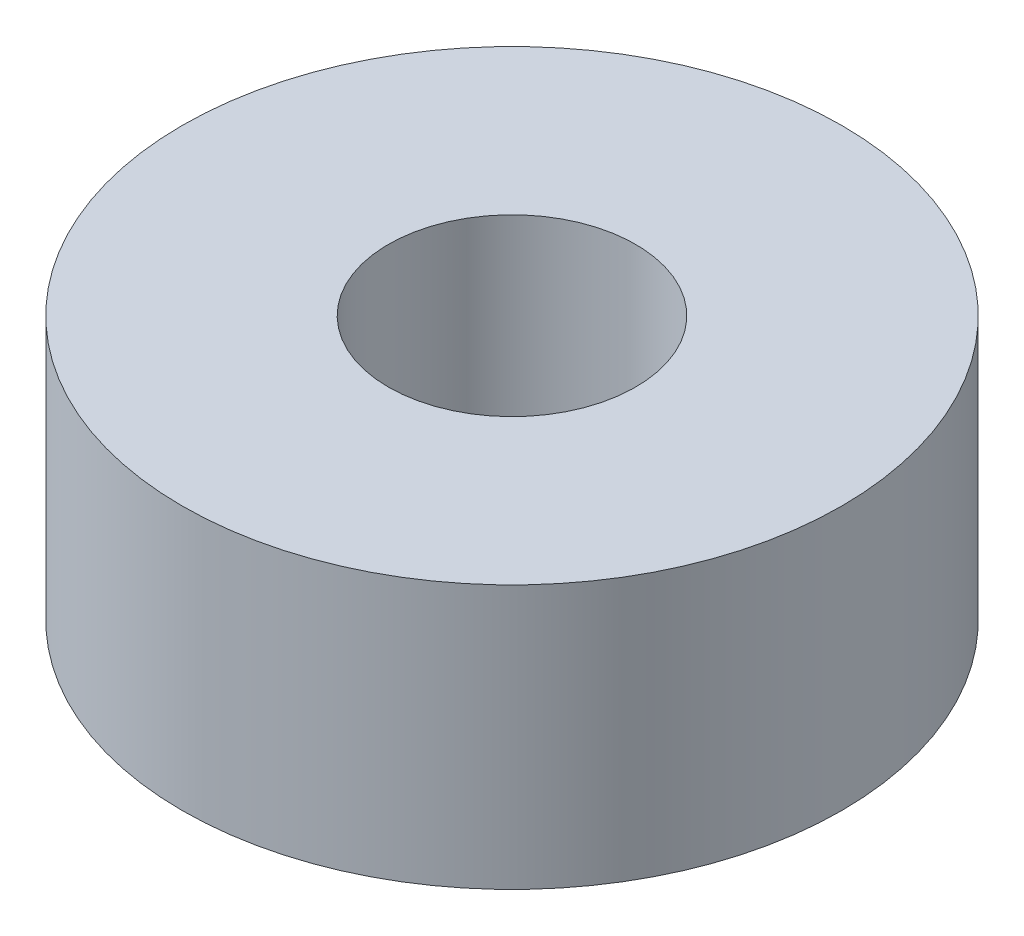
from build123d import *

# Parameters (mm, degrees)
SKETCH1_R           = 20
BOSS_EXTRUDE1_DEPTH = 16
SKETCH2_R           = 7.5
CUT_EXTRUDE1_DEPTH  = 33.496153619


with BuildPart() as part:
    # Sketch1 → Boss-Extrude1 (new body)
    with BuildSketch(Plane(origin=(0, 0, 0), x_dir=(1, 0, 0), z_dir=(0, 1, 0))):
        Circle(SKETCH1_R)
    extrude(amount=BOSS_EXTRUDE1_DEPTH)

    # Sketch2 → Cut-Extrude1 (cut, through all)
    with BuildSketch(Plane(origin=(0, 0, 0), x_dir=(1, 0, 0), z_dir=(0, 1, 0))):
        Circle(SKETCH2_R)
    extrude(amount=CUT_EXTRUDE1_DEPTH, mode=Mode.SUBTRACT)


solid = part.part
